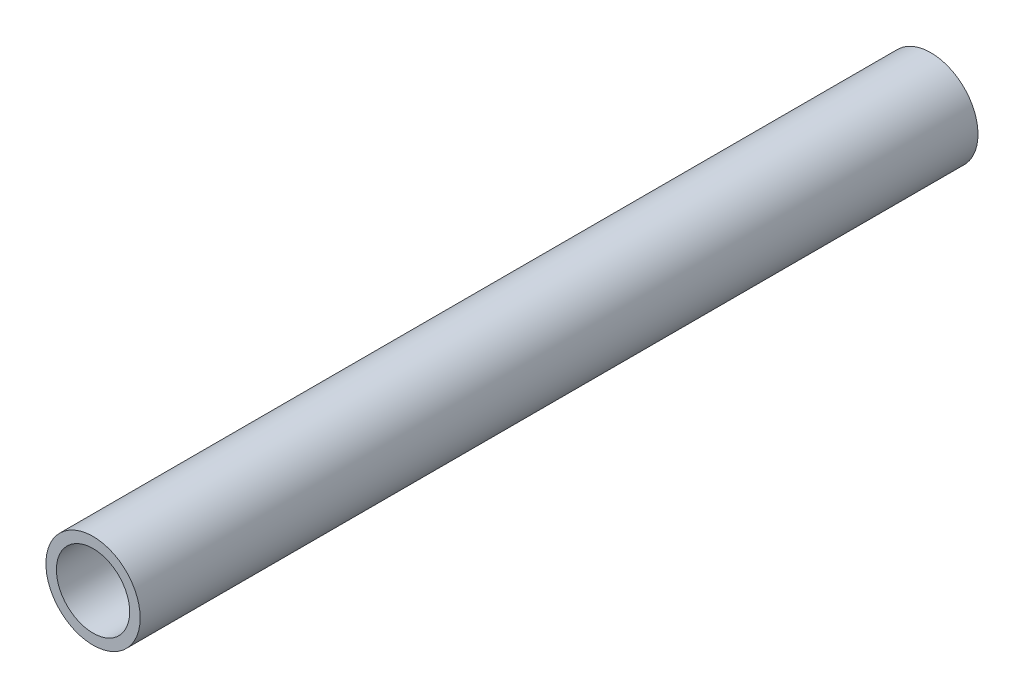
from build123d import *

# Parameters (mm, degrees)
SKETCH1_R           = 4.5
SKETCH1_R_2         = 3.5
BOSS_EXTRUDE1_DEPTH = 80


with BuildPart() as part:
    # Sketch1 → Boss-Extrude1 (new body)
    with BuildSketch(Plane.XY):
        Circle(SKETCH1_R)
        Circle(SKETCH1_R_2, mode=Mode.SUBTRACT)
    extrude(amount=BOSS_EXTRUDE1_DEPTH)


solid = part.part
